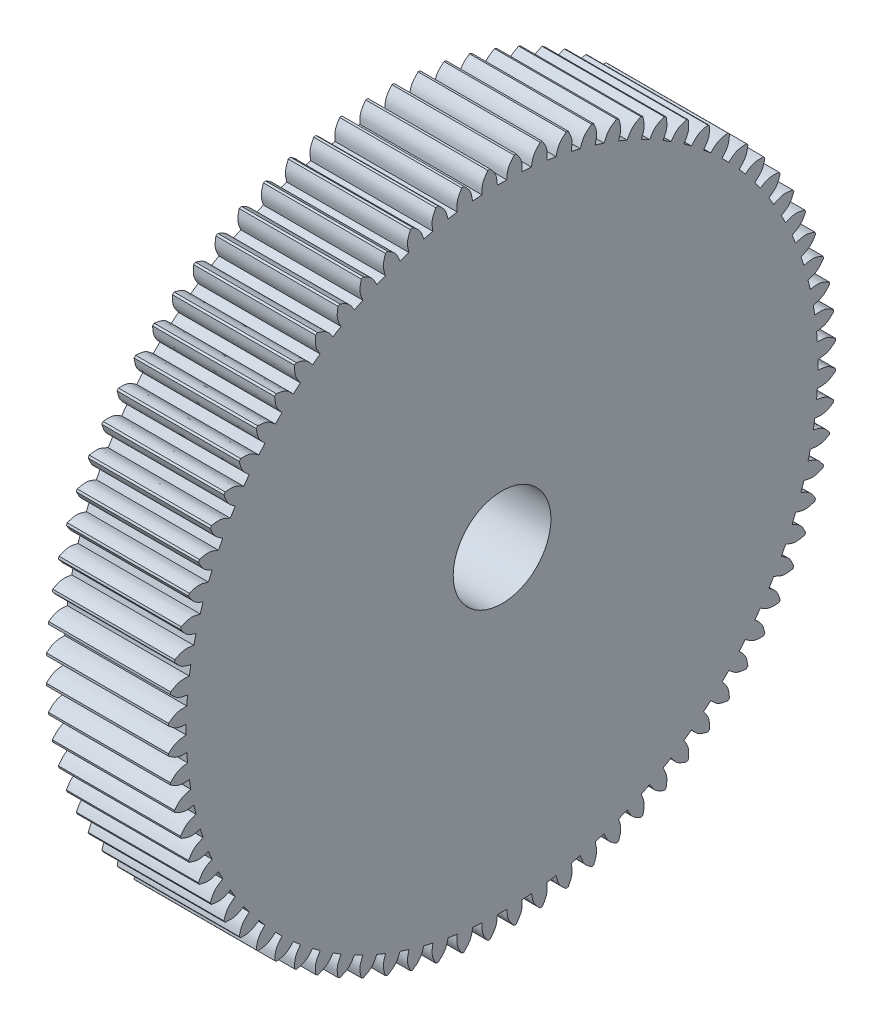
from build123d import *

# Parameters (mm, degrees)
RITNING_1_W      = 15
RITNING_1_H      = 35
KUGGLUCKA_DEPTH  = 15
CIRPATTERN_COUNT = 80


with BuildPart() as part:
    # Ritning 1 → Kugghjulsämne (revolve)
    with BuildSketch(Plane.XY, mode=Mode.PRIVATE) as kugghjuls_mne_sk:
        with Locations((0, 3)):
            Rectangle(RITNING_1_W, RITNING_1_H)
    revolve(kugghjuls_mne_sk.sketch.rotate(Axis((-7.5, -20.5, 0), (1, 0, 0)), 90), axis=Axis((-7.5, -20.5, 0), (1, 0, 0)))

    # Ritning 2 → Kugglucka (cut)
    with BuildSketch(Plane.ZY.offset(7.5)):
        with BuildLine():
            Line((1.472484681, 20.473549869), (0, 21.94603455))
            Line((0, 21.94603455), (-1.472484681, 20.473549869))
            add(Edge.make_bspline(
                [(-1.472484681, 20.473549869), (-1.203815984, 20.162882156), (-0.662643204, 19.537111787), (-0.603963513, 18.711486239), (-0.57441573, 18.29574779)],
                knots=[0, 0, 0, 0, 0.496456415, 1, 1, 1, 1], degree=3))
            ThreePointArc((-0.57441573, 18.29574779), (0, 18.3), (0.57441573, 18.29574779))
            add(Edge.make_bspline(
                [(1.472484681, 20.473549869), (1.203815984, 20.162882156), (0.662643204, 19.537111787), (0.603963513, 18.711486239), (0.57441573, 18.29574779)],
                knots=[0, 0, 0, 0, 0.496456415, 1, 1, 1, 1], degree=3))
        make_face()
    kugglucka = extrude(amount=-KUGGLUCKA_DEPTH, mode=Mode.SUBTRACT)

    # CirPattern: Kugglucka ×80 about axis
    cirpattern_axis = Axis((-7.5, -20.5, 0), (-1, 0, 0))
    for i in range(1, CIRPATTERN_COUNT):
        add(kugglucka.rotate(cirpattern_axis, i * 360 / CIRPATTERN_COUNT), mode=Mode.SUBTRACT)


solid = part.part
